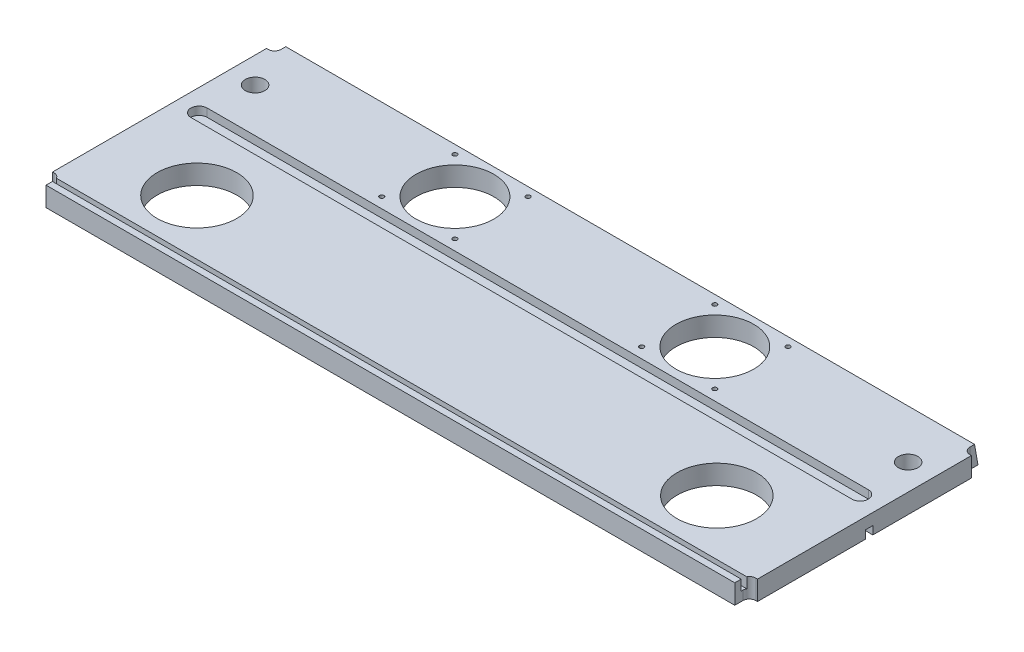
from build123d import *

# Parameters (mm, degrees)
SKETCH1_W               = 673.1
SKETCH1_H               = 237.6932
SKETCH1_R               = 38.89375
BOSS_EXTRUDE1_DEPTH     = 9.525
SKETCH2_W               = 673.1
SKETCH2_H               = 4.699
CUT_EXTRUDE1_DEPTH      = 10.16
SKETCH3_W               = 7.9375
SKETCH3_H               = 209.1182
BOSS_EXTRUDE2_DEPTH     = 19.05
FILLET1_R               = 6.35
CUT_EXTRUDE2_DEPTH      = 692.395195502
CUT_EXTRUDE2_DEPTH_BACK = 692.395195502
CUT_EXTRUDE3_START      = -19.05
CUT_EXTRUDE3_DEPTH      = 7.9375
CUT_EXTRUDE4_DEPTH      = 365.9096525
CUT_EXTRUDE4_DEPTH_BACK = 365.9096525
SKETCH6_R               = 9.525
SKETCH6_R_2             = 38
SKETCH6_R_3             = 2.159
CUT_EXTRUDE5_DEPTH      = 365.536524388
CUT_EXTRUDE5_DEPTH_BACK = 365.536524388
SKETCH8_W               = 7
SKETCH8_H               = 7.9375


with BuildPart() as part:
    # Sketch1 → Boss-Extrude1 (new, symmetric)
    with BuildSketch(Plane(origin=(0, 0, 0), x_dir=(1, 0, 0), z_dir=(0, 1, 0))):
        Rectangle(SKETCH1_W, SKETCH1_H)
        with Locations(Location((-254, -53.8734, 0), (0, 0, 90))):
            Circle(SKETCH1_R, mode=Mode.SUBTRACT)
        with Locations(Location((254, -53.8734, 0), (0, 0, 90))):
            Circle(SKETCH1_R, mode=Mode.SUBTRACT)
    extrude(amount=BOSS_EXTRUDE1_DEPTH, both=True)

    # Sketch2 → Cut-Extrude1 (cut)
    with BuildSketch(Plane(origin=(0, 9.525, 0), x_dir=(1, 0, 0), z_dir=(0, 1, 0))):
        with Locations((0, -110.2395052)):
            Rectangle(SKETCH2_W, SKETCH2_H)
    extrude(amount=-CUT_EXTRUDE1_DEPTH, mode=Mode.SUBTRACT)

    # Sketch3 → Boss-Extrude2 (add)
    with BuildSketch(Plane(origin=(0, 9.525, 0), x_dir=(1, 0, 0), z_dir=(0, 1, 0))):
        with Locations((-340.51875, 0)):
            Rectangle(SKETCH3_W, SKETCH3_H)
        with Locations((340.51875, 0)):
            Rectangle(SKETCH3_W, SKETCH3_H)
    extrude(amount=-BOSS_EXTRUDE2_DEPTH)

    # Fillet1
    # the kernel refuses this fillet: 6.35 mm, written as the material it adds along each edge
    with BuildSketch(Plane(origin=(336.55, 9.525, -104.5591), x_dir=(0, 0, -1), z_dir=(0, -1, 0))) as fillet1_piece_1:
        with BuildLine():
            CenterArc((FILLET1_R, FILLET1_R), FILLET1_R, 180, 90)
            Line((0, FILLET1_R), (0, 0))
            Line((0, 0), (FILLET1_R, 0))
        make_face()
    extrude(amount=19.05)
    with BuildSketch(Plane(origin=(336.55, 9.525, 104.5591), x_dir=(0, 0, 1), z_dir=(0, -1, 0))) as fillet1_piece_2_section:
        with BuildLine():
            CenterArc((FILLET1_R, -FILLET1_R), FILLET1_R, 90, 90)
            Line((0, -FILLET1_R), (0, 0))
            Line((0, 0), (FILLET1_R, 0))
        make_face()
    fillet1_piece_2 = extrude(amount=19.05, mode=Mode.PRIVATE)
    fillet1_piece_2 = split(fillet1_piece_2, bisect_by=Plane(origin=(338.149651187, -0.635, 105.638113303), z_dir=(0, 1, 0)), keep=Keep.TOP, mode=Mode.PRIVATE)
    fillet1_piece_2 = split(fillet1_piece_2, bisect_by=Plane(origin=(338.149651187, 4.445, 107.8900052), z_dir=(0, 0, -1)), keep=Keep.TOP, mode=Mode.PRIVATE)
    add(fillet1_piece_2)
    with BuildSketch(Plane(origin=(336.55, 9.525, 104.5591), x_dir=(0, 0, 1), z_dir=(0, -1, 0))) as fillet1_piece_3_section:
        with BuildLine():
            CenterArc((FILLET1_R, -FILLET1_R), FILLET1_R, 90, 90)
            Line((0, -FILLET1_R), (0, 0))
            Line((0, 0), (FILLET1_R, 0))
        make_face()
    fillet1_piece_3 = extrude(amount=19.05, mode=Mode.PRIVATE)
    fillet1_piece_3 = split(fillet1_piece_3, bisect_by=Plane(origin=(336.678320254, -0.635, 108.894134697), z_dir=(0, -1, 0)), keep=Keep.TOP, mode=Mode.PRIVATE)
    fillet1_piece_3 = split(fillet1_piece_3, bisect_by=Plane(origin=(336.678320254, -5.08, 107.8900052), z_dir=(0, 0, 1)), keep=Keep.TOP, mode=Mode.PRIVATE)
    add(fillet1_piece_3)
    with BuildSketch(Plane(origin=(336.55, 9.525, 104.5591), x_dir=(0, 0, 1), z_dir=(0, -1, 0))) as fillet1_piece_4_section:
        with BuildLine():
            CenterArc((FILLET1_R, -FILLET1_R), FILLET1_R, 90, 90)
            Line((0, -FILLET1_R), (0, 0))
            Line((0, 0), (FILLET1_R, 0))
        make_face()
    fillet1_piece_4 = extrude(amount=19.05, mode=Mode.PRIVATE)
    fillet1_piece_4 = split(fillet1_piece_4, bisect_by=Plane(origin=(338.149651187, -0.635, 105.638113303), z_dir=(0, -1, 0)), keep=Keep.TOP, mode=Mode.PRIVATE)
    fillet1_piece_4 = split(fillet1_piece_4, bisect_by=Plane(origin=(338.149651187, -5.08, 107.8900052), z_dir=(0, 0, -1)), keep=Keep.TOP, mode=Mode.PRIVATE)
    add(fillet1_piece_4)
    with BuildSketch(Plane(origin=(-336.55, 9.525, -104.5591), x_dir=(0, 0, -1), z_dir=(0, -1, 0))) as fillet1_piece_5:
        with BuildLine():
            CenterArc((FILLET1_R, -FILLET1_R), FILLET1_R, 90, 90)
            Line((0, -FILLET1_R), (0, 0))
            Line((0, 0), (FILLET1_R, 0))
        make_face()
    extrude(amount=19.05)
    with BuildSketch(Plane(origin=(-336.55, 9.525, 104.5591), x_dir=(0, 0, 1), z_dir=(0, -1, 0))) as fillet1_piece_6_section:
        with BuildLine():
            CenterArc((FILLET1_R, FILLET1_R), FILLET1_R, 180, 90)
            Line((0, FILLET1_R), (0, 0))
            Line((0, 0), (FILLET1_R, 0))
        make_face()
    fillet1_piece_6 = extrude(amount=19.05, mode=Mode.PRIVATE)
    fillet1_piece_6 = split(fillet1_piece_6, bisect_by=Plane(origin=(-338.149651187, 4.445, 107.8900052), z_dir=(0, 0, -1)), keep=Keep.TOP, mode=Mode.PRIVATE)
    fillet1_piece_6 = split(fillet1_piece_6, bisect_by=Plane(origin=(-338.149651187, -0.635, 105.638113303), z_dir=(0, 1, 0)), keep=Keep.TOP, mode=Mode.PRIVATE)
    add(fillet1_piece_6)
    with BuildSketch(Plane(origin=(-336.55, 9.525, 104.5591), x_dir=(0, 0, 1), z_dir=(0, -1, 0))) as fillet1_piece_7_section:
        with BuildLine():
            CenterArc((FILLET1_R, FILLET1_R), FILLET1_R, 180, 90)
            Line((0, FILLET1_R), (0, 0))
            Line((0, 0), (FILLET1_R, 0))
        make_face()
    fillet1_piece_7 = extrude(amount=19.05, mode=Mode.PRIVATE)
    fillet1_piece_7 = split(fillet1_piece_7, bisect_by=Plane(origin=(-336.678320254, -5.08, 107.8900052), z_dir=(0, 0, 1)), keep=Keep.TOP, mode=Mode.PRIVATE)
    fillet1_piece_7 = split(fillet1_piece_7, bisect_by=Plane(origin=(-336.678320254, -0.635, 108.894134697), z_dir=(0, -1, 0)), keep=Keep.TOP, mode=Mode.PRIVATE)
    add(fillet1_piece_7)
    with BuildSketch(Plane(origin=(-336.55, 9.525, 104.5591), x_dir=(0, 0, 1), z_dir=(0, -1, 0))) as fillet1_piece_8_section:
        with BuildLine():
            CenterArc((FILLET1_R, FILLET1_R), FILLET1_R, 180, 90)
            Line((0, FILLET1_R), (0, 0))
            Line((0, 0), (FILLET1_R, 0))
        make_face()
    fillet1_piece_8 = extrude(amount=19.05, mode=Mode.PRIVATE)
    fillet1_piece_8 = split(fillet1_piece_8, bisect_by=Plane(origin=(-338.149651187, -5.08, 107.8900052), z_dir=(0, 0, -1)), keep=Keep.TOP, mode=Mode.PRIVATE)
    fillet1_piece_8 = split(fillet1_piece_8, bisect_by=Plane(origin=(-338.149651187, -0.635, 105.638113303), z_dir=(0, -1, 0)), keep=Keep.TOP, mode=Mode.PRIVATE)
    add(fillet1_piece_8)

    # Sketch4 → Cut-Extrude2 (cut, two sides: drawn at the far end of the back side and taken through both)
    with BuildSketch(Plane(origin=(336.55, 0, 0), x_dir=(0, 0, -1), z_dir=(1, 0, 0)).offset(-CUT_EXTRUDE2_DEPTH_BACK)):
        Polygon((118.8466, -9.525), (115.487571018, 9.525), (118.8466, 9.525), align=None)
    extrude(amount=CUT_EXTRUDE2_DEPTH + CUT_EXTRUDE2_DEPTH_BACK, mode=Mode.SUBTRACT)

    # Sketch5 → Cut-Extrude3 (cut)
    with BuildSketch(Plane.XZ.offset(9.525).offset(CUT_EXTRUDE3_START)):
        with BuildLine():
            Line((-323.05625, -9.201160668), (323.05625, -9.201160668))
            ThreePointArc((323.05625, -9.201160668), (331.05725, -17.202160668), (323.05625, -25.203160668))
            Line((323.05625, -25.203160668), (-323.05625, -25.203160668))
            ThreePointArc((-323.05625, -25.203160668), (-331.05725, -17.202160668), (-323.05625, -9.201160668))
        make_face()
    extrude(amount=CUT_EXTRUDE3_DEPTH, mode=Mode.SUBTRACT)

    # Sketch6 → Cut-Extrude4 (cut, two sides: drawn at the far end of the back side and taken through both)
    with BuildSketch(Plane(origin=(0, 9.525, 0), x_dir=(1, 0, 0), z_dir=(0, 1, 0)).offset(-CUT_EXTRUDE4_DEPTH_BACK)):
        with Locations(Location((-319.0875, 68.0466, 0), (0, 0, 270))):
            Circle(SKETCH6_R)
        with Locations(Location((319.0875, 68.0466, 0), (0, 0, 270))):
            Circle(SKETCH6_R)
        with Locations(Location((127, 71.2216, 0), (0, 0, 270))):
            Circle(SKETCH6_R_2)
        with Locations(Location((-127, 71.2216, 0), (0, 0, 270))):
            Circle(SKETCH6_R_2)
        with Locations(Location((162.75, 106.9716, 0), (0, 0, 270))):
            Circle(SKETCH6_R_3)
        with Locations(Location((162.75, 35.4716, 0), (0, 0, 270))):
            Circle(SKETCH6_R_3)
        with Locations(Location((91.25, 35.4716, 0), (0, 0, 270))):
            Circle(SKETCH6_R_3)
        with Locations(Location((91.25, 106.9716, 0), (0, 0, 270))):
            Circle(SKETCH6_R_3)
        with Locations(Location((-91.25, 106.9716, 0), (0, 0, 90))):
            Circle(SKETCH6_R_3)
        with Locations(Location((-91.25, 35.4716, 0), (0, 0, 90))):
            Circle(SKETCH6_R_3)
        with Locations(Location((-162.75, 35.4716, 0), (0, 0, 90))):
            Circle(SKETCH6_R_3)
        with Locations(Location((-162.75, 106.9716, 0), (0, 0, 90))):
            Circle(SKETCH6_R_3)
    extrude(amount=CUT_EXTRUDE4_DEPTH + CUT_EXTRUDE4_DEPTH_BACK, mode=Mode.SUBTRACT)

    # Sketch8 → Cut-Extrude5 (cut, two sides: drawn at the far end of the back side and taken through both)
    with BuildSketch(Plane(origin=(0, 0, 0), x_dir=(0, 0, -1), z_dir=(1, 0, 0)).offset(-CUT_EXTRUDE5_DEPTH_BACK)):
        with Locations((4.6533886, -5.55625)):
            Rectangle(SKETCH8_W, SKETCH8_H)
    extrude(amount=CUT_EXTRUDE5_DEPTH + CUT_EXTRUDE5_DEPTH_BACK, mode=Mode.SUBTRACT)


solid = part.part
